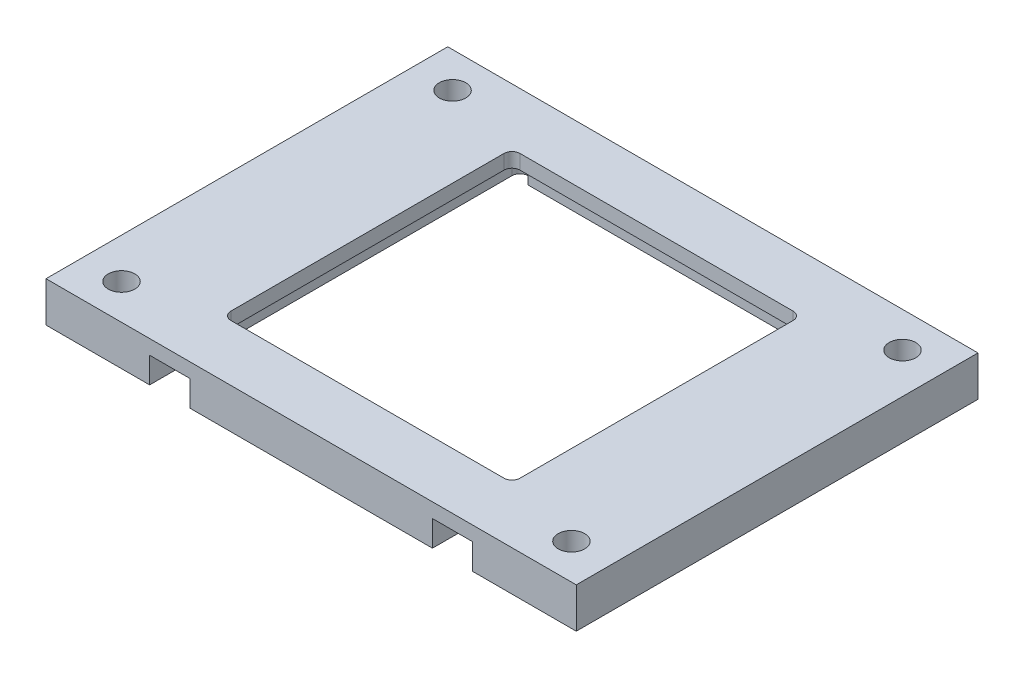
from build123d import *

# Parameters (mm, degrees)
SKETCH1_W           = 66
SKETCH1_H           = 50
SKETCH1_R           = 1.65
BOSS_EXTRUDE1_DEPTH = 5
SKETCH2_W           = 36
SKETCH2_H           = 36
BOSS_EXTRUDE2_DEPTH = 1.8
CUT_EXTRUDE1_REACH  = 62.117
SKETCH3_W           = 5
SKETCH3_H           = 3.2
FILLET1_R           = 1


with BuildPart() as part:
    # Sketch1 → Boss-Extrude1 (new body)
    with BuildSketch(Plane(origin=(0, 0, 0), x_dir=(1, 0, 0), z_dir=(0, 1, 0))):
        Rectangle(SKETCH1_W, SKETCH1_H)
        with Locations(Location((-28, 20.6, 0), (0, 0, 270))):
            Circle(SKETCH1_R, mode=Mode.SUBTRACT)
        with Locations(Location((28, 20.6, 0), (0, 0, 270))):
            Circle(SKETCH1_R, mode=Mode.SUBTRACT)
        with Locations(Location((-28, -20.6, 0), (0, 0, 270))):
            Circle(SKETCH1_R, mode=Mode.SUBTRACT)
        with Locations(Location((28, -20.6, 0), (0, 0, 270))):
            Circle(SKETCH1_R, mode=Mode.SUBTRACT)
        Polygon((20.1, -20.1), (20.1, 21.1), (18.1, 21.1), (18.1, 20.1), (-18.1, 20.1), (-18.1, 21.1), (-20.1, 21.1), (-20.1, -20.1), align=None, mode=Mode.SUBTRACT)
    extrude(amount=BOSS_EXTRUDE1_DEPTH)

    # Sketch2 → Boss-Extrude2 (add)
    with BuildSketch(Plane(origin=(0, 5, 0), x_dir=(1, 0, 0), z_dir=(0, 1, 0))):
        Polygon((-20.1, 21.1), (-20.1, -20.1), (20.1, -20.1), (20.1, 21.1), (18.1, 21.1), (18.1, 20.1), (-18.1, 20.1), (-18.1, 21.1), align=None)
        Rectangle(SKETCH2_W, SKETCH2_H, mode=Mode.SUBTRACT)
    extrude(amount=-BOSS_EXTRUDE2_DEPTH)

    # Sketch3 → Cut-Extrude1 (cut, up to next)
    with BuildSketch(Plane.XY.offset(25), mode=Mode.PRIVATE) as cut_extrude1_sk1:
        with Locations((-17.6, 1.6)):
            Rectangle(SKETCH3_W, SKETCH3_H)
    cut_extrude1_tool1 = extrude(cut_extrude1_sk1.sketch, amount=-CUT_EXTRUDE1_REACH, mode=Mode.PRIVATE) & part.part
    # Sketch3 → Cut-Extrude1 (cut, up to next)
    with BuildSketch(Plane.XY.offset(25), mode=Mode.PRIVATE) as cut_extrude1_sk2:
        with Locations((17.6, 1.6)):
            Rectangle(SKETCH3_W, SKETCH3_H)
    cut_extrude1_tool2 = extrude(cut_extrude1_sk2.sketch, amount=-CUT_EXTRUDE1_REACH, mode=Mode.PRIVATE) & part.part
    add(cut_extrude1_tool1.solids().sort_by_distance((-17.6, 1.6, 25))[0], mode=Mode.SUBTRACT)
    add(cut_extrude1_tool2.solids().sort_by_distance((17.6, 1.6, 25))[0], mode=Mode.SUBTRACT)

    # Fillet1
    fillet1_edges = [part.edges().sort_by_distance(p)[0] for p in [
        (-18, 4.1, 18),
        (18, 4.1, 18),
        (18, 4.1, -18),
        (-18, 4.1, -18),
        (-20.1, 1.6, -21.1),
        (-18.1, 1.6, -21.1),
        (18.1, 1.6, -21.1),
        (20.1, 1.6, -21.1),
    ]]
    fillet(fillet1_edges, radius=FILLET1_R - 0.0001)  # a hair under: the kernel refuses the full size


solid = part.part
